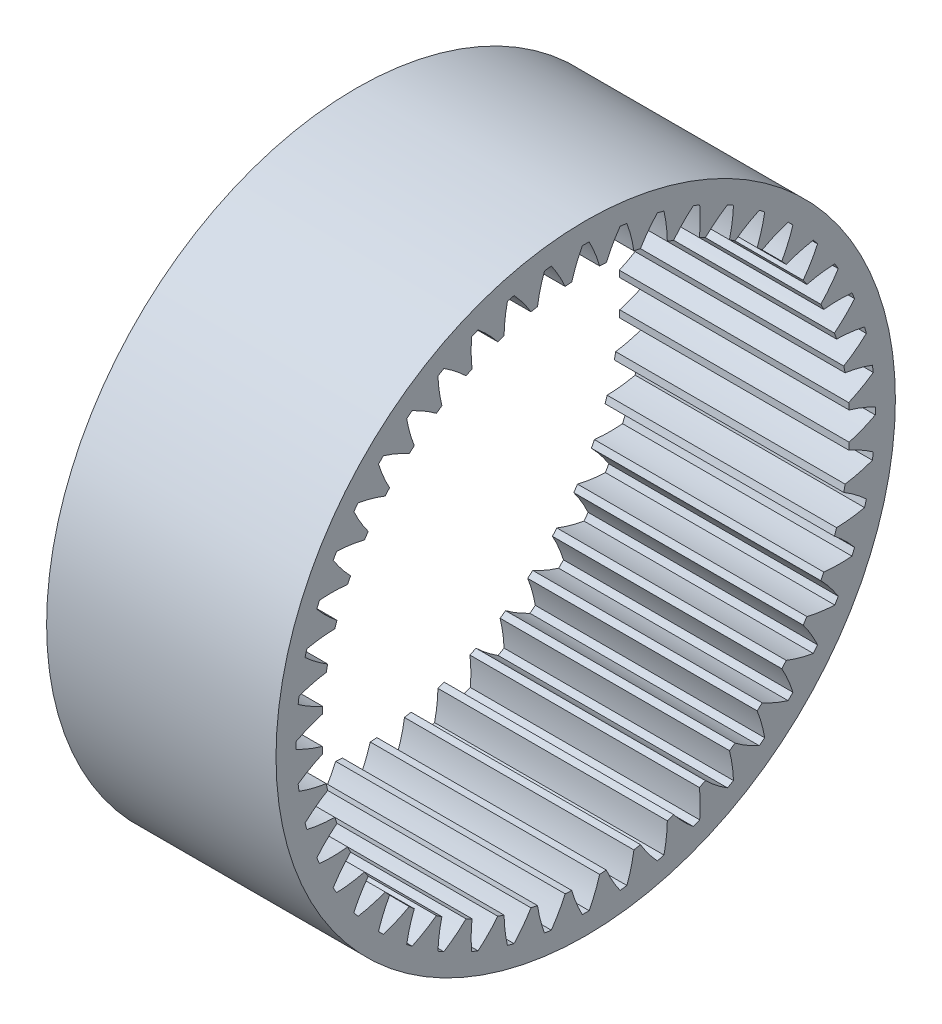
from build123d import *

# Parameters (mm, degrees)
BASPROSKE_W     = 50
BASPROSKE_H     = 10
TOOTHCUT_DEPTH  = 108.761310311
TEETHCUTS_COUNT = 48
TEETHCUTS_ANGLE = 352.5


with BuildPart() as part:
    # BasProSke → Base-Revolve (revolve)
    with BuildSketch(Plane(origin=(0, 0, 0), x_dir=(1, 0, 0), z_dir=(0, 1, 0))):
        with Locations((25, 62.5)):
            Rectangle(BASPROSKE_W, BASPROSKE_H)
    revolve(axis=Axis((-10, 0, 0), (1, 0, 0)))

    # TooCutSke → ToothCut (cut, through all)
    with BuildSketch(Plane(origin=(0, 0, 0), x_dir=(0, 0, -1), z_dir=(1, 0, 0))):
        with BuildLine():
            ThreePointArc((3.039998108, 57.394146537), (2.040403675, 60.317014763), (0.74554281, 63.12159727))
            ThreePointArc((0.74554281, 63.12159727), (0, 63.126), (-0.74554281, 63.12159727))
            ThreePointArc((-0.74554281, 63.12159727), (-2.040403675, 60.317014763), (-3.039998108, 57.394146537))
            ThreePointArc((-3.039998108, 57.394146537), (0, 57.4746), (3.039998108, 57.394146537))
        make_face()
    toothcut = extrude(amount=TOOTHCUT_DEPTH, mode=Mode.SUBTRACT)

    # TeethCuts: ToothCut ×48 about axis
    teethcuts_axis = Axis((-10, 0, 0), (1, 0, 0))
    for i in range(1, TEETHCUTS_COUNT):
        add(toothcut.rotate(teethcuts_axis, i * TEETHCUTS_ANGLE / (TEETHCUTS_COUNT - 1)), mode=Mode.SUBTRACT)


solid = part.part
